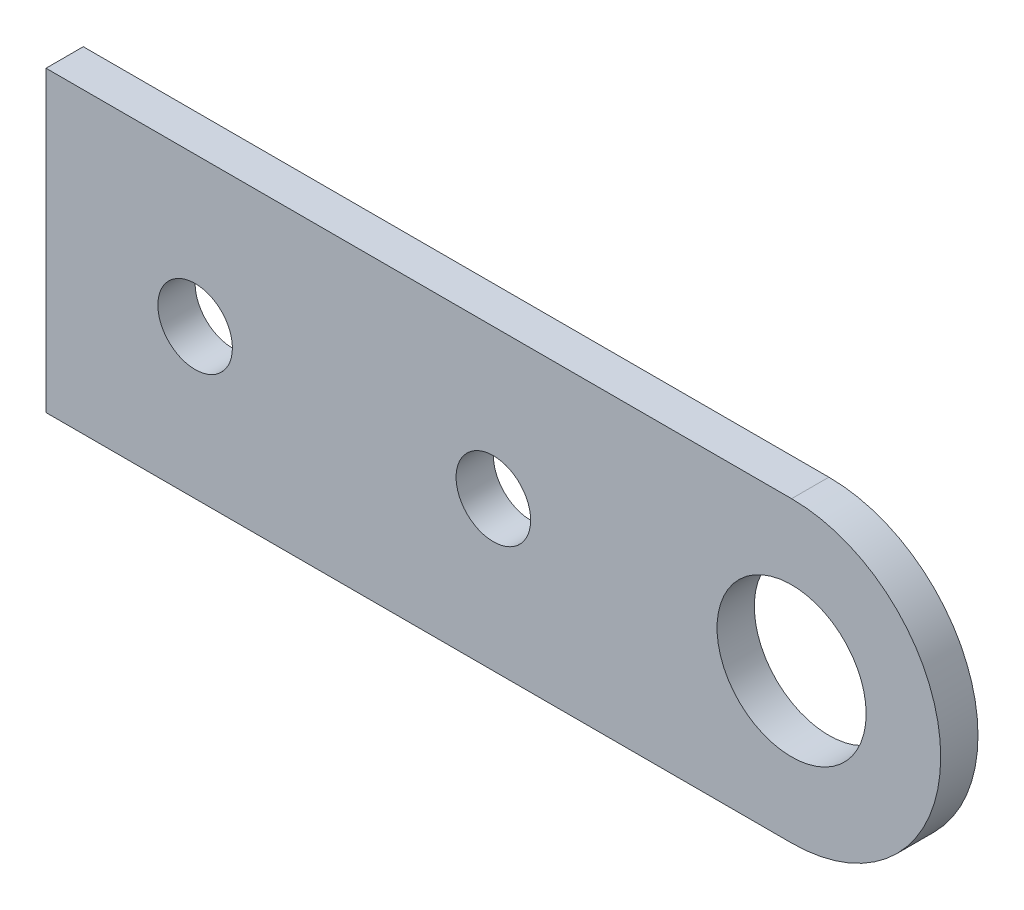
from build123d import *

# Parameters (mm, degrees)
SKETCH1_R          = 6.35
SKETCH1_R_2        = 3.175
BASE_FLANGE1_DEPTH = 3.175


# Sheet-metal steps are written as plain solids
with BuildPart() as part:
    # Sketch1 → Base-Flange1 (new body)
    with BuildSketch(Plane.XY):
        with BuildLine():
            Line((0, 12.7), (-63.5, 12.7))
            Line((-63.5, 12.7), (-63.5, -12.7))
            Line((-63.5, -12.7), (0, -12.7))
            ThreePointArc((0, -12.7), (12.7, 0), (0, 12.7))
        make_face()
        Circle(SKETCH1_R, mode=Mode.SUBTRACT)
        with Locations((-50.8, 0)):
            Circle(SKETCH1_R_2, mode=Mode.SUBTRACT)
        with Locations((-25.4, 0)):
            Circle(SKETCH1_R_2, mode=Mode.SUBTRACT)
    extrude(amount=-BASE_FLANGE1_DEPTH)


solid = part.part
